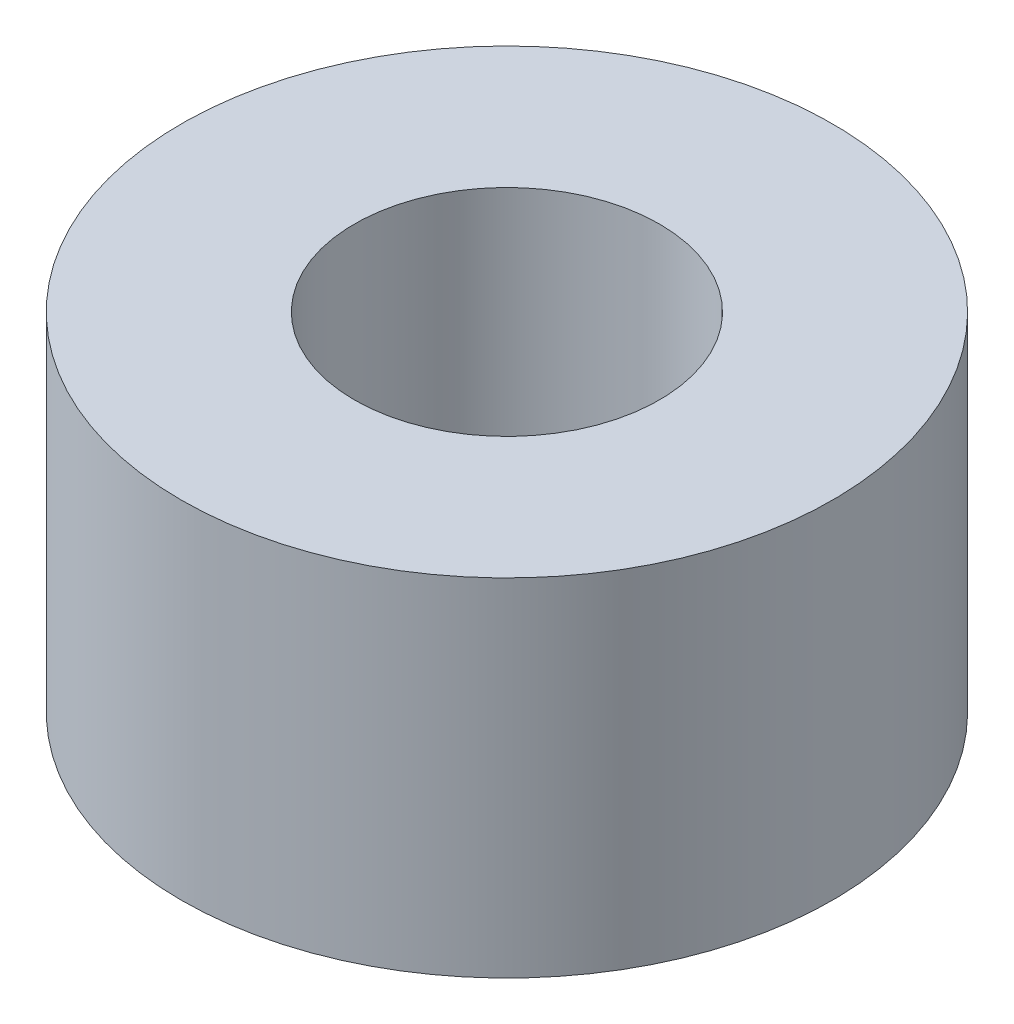
from build123d import *

# Parameters (mm, degrees)
SKETCH1_R           = 5.969
SKETCH1_R_2         = 2.794
BOSS_EXTRUDE1_DEPTH = 6.35


with BuildPart() as part:
    # Sketch1 → Boss-Extrude1 (new body)
    with BuildSketch(Plane(origin=(0, 0, 0), x_dir=(1, 0, 0), z_dir=(0, 1, 0))):
        Circle(SKETCH1_R)
        Circle(SKETCH1_R_2, mode=Mode.SUBTRACT)
    extrude(amount=BOSS_EXTRUDE1_DEPTH)


solid = part.part
